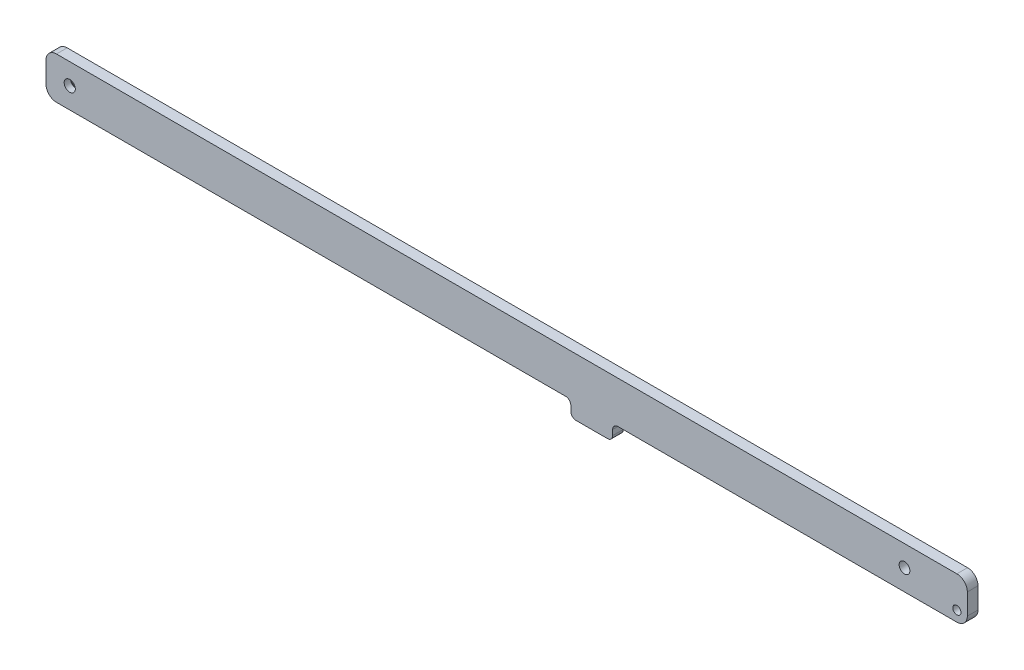
from build123d import *

# Parameters (mm, degrees)
SKETCH1_R                                           = 2.4892
BOSS_EXTRUDE1_DEPTH                                 = 6.477
FILLET2_R                                           = 6.35
FILLET3_R                                           = 3.175
SKETCH2_R                                           = 3.2639
CUT_EXTRUDE1_DEPTH                                  = 560.526948516
CSK_FOR_1_4_FLAT_HEAD_MACHINE_SCREW_100_D           = 6.7564
CSK_FOR_1_4_FLAT_HEAD_MACHINE_SCREW_100_DEPTH       = 19.05
CSK_FOR_1_4_FLAT_HEAD_MACHINE_SCREW_100_CSINK_D     = 12.8778
CSK_FOR_1_4_FLAT_HEAD_MACHINE_SCREW_100_CSINK_ANGLE = 100
CSK_FOR_1_4_FLAT_HEAD_MACHINE_SCREW_100_TIP         = 2.029827343


with BuildPart() as part:
    # Sketch1 → Boss-Extrude1 (new body)
    with BuildSketch(Plane.XY):
        Polygon((0, 25.4), (0, 0), (40.53078, 0), (318.31026, 0), (318.31026, -9.525), (343.71026, -9.525), (343.71026, 0), (558.8, 0), (558.8, 25.4), (40.530665192, 25.4), align=None)
        with Locations((552.45, 6.35)):
            Circle(SKETCH1_R, mode=Mode.SUBTRACT)
    extrude(amount=BOSS_EXTRUDE1_DEPTH)

    # Fillet2
    fillet2_edges = [part.edges().sort_by_distance(p)[0] for p in [
        (558.8, 25.4, 3.2385),
        (0, 0, 3.2385),
        (0, 25.4, 3.2385),
        (558.8, 0, 3.2385),
    ]]
    fillet(fillet2_edges, radius=FILLET2_R)


with BuildPart() as body_2:
    # Mirror2: mirrored copy
    add(part.part.mirror(Plane.XY))

    # Fillet3
    fillet3_edges = [body_2.edges().sort_by_distance(p)[0] for p in [
        (343.71026, 0, -3.2385),
        (343.71026, -9.525, -3.2385),
        (318.31026, -9.525, -3.2385),
        (318.31026, 0, -3.2385),
    ]]
    fillet(fillet3_edges, radius=FILLET3_R)

    # Sketch2 → Cut-Extrude1 (cut, through all)
    with BuildSketch(Plane.XY.offset(6.477)):
        with Locations((520.7, 12.7)):
            Circle(SKETCH2_R)
    extrude(amount=-CUT_EXTRUDE1_DEPTH, mode=Mode.SUBTRACT)

    # CSK for 1/4 Flat Head Machine Screw (100)1
    with Locations(Plane(origin=(0, 0, -6.477), x_dir=(1, 0, 0), z_dir=(0, 0, -1))):
        with Locations((14.393926, -12.7)):
            CounterSinkHole(CSK_FOR_1_4_FLAT_HEAD_MACHINE_SCREW_100_D / 2, CSK_FOR_1_4_FLAT_HEAD_MACHINE_SCREW_100_CSINK_D / 2, depth=CSK_FOR_1_4_FLAT_HEAD_MACHINE_SCREW_100_DEPTH, counter_sink_angle=CSK_FOR_1_4_FLAT_HEAD_MACHINE_SCREW_100_CSINK_ANGLE)
            with Locations((0, 0, -(CSK_FOR_1_4_FLAT_HEAD_MACHINE_SCREW_100_DEPTH + CSK_FOR_1_4_FLAT_HEAD_MACHINE_SCREW_100_TIP / 2))):  # 118° drill point
                Cone(0, CSK_FOR_1_4_FLAT_HEAD_MACHINE_SCREW_100_D / 2, CSK_FOR_1_4_FLAT_HEAD_MACHINE_SCREW_100_TIP, mode=Mode.SUBTRACT)


solid = body_2.part
